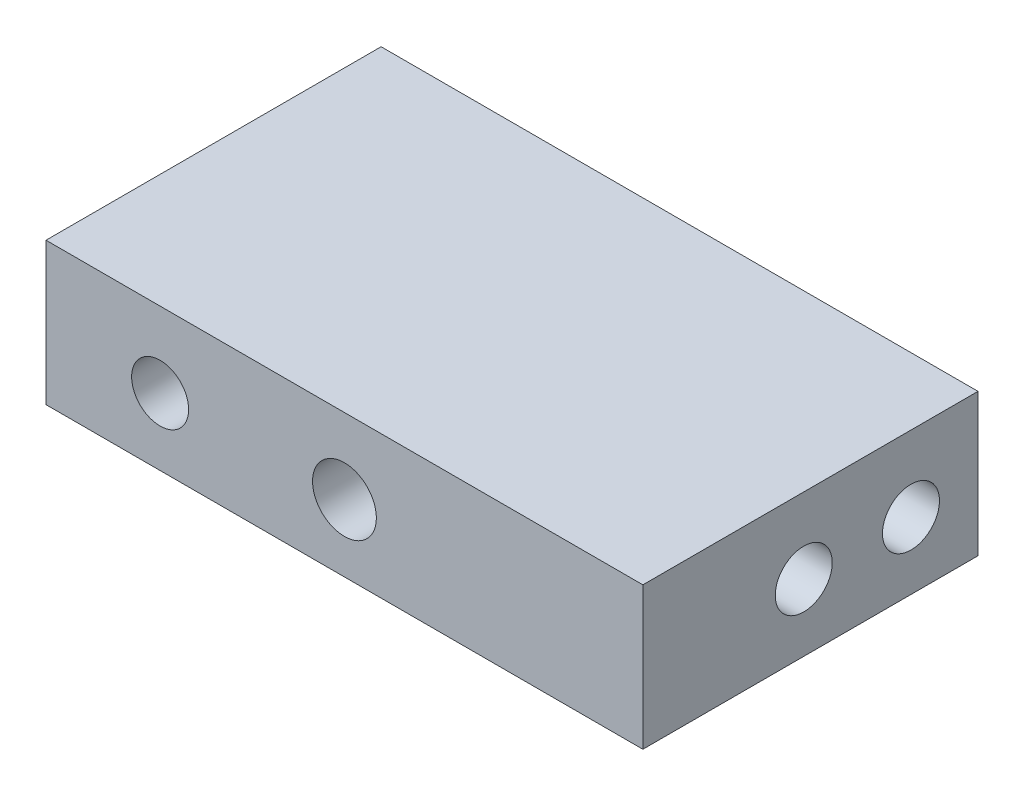
from build123d import *

# Parameters (mm, degrees)
SKETCH1_W           = 56.55
SKETCH1_H           = 12.7
BOSS_EXTRUDE1_DEPTH = 31.75
SKETCH2_R           = 2.7
SKETCH2_R_2         = 3.025
CUT_EXTRUDE1_DEPTH  = 10
SKETCH3_R           = 2.7
CUT_EXTRUDE2_DEPTH  = 8
SKETCH4_W           = 56.55
SKETCH4_H           = 31.75
BOSS_EXTRUDE2_DEPTH = 0.79375


with BuildPart() as part:
    # Sketch1 → Boss-Extrude1 (new body)
    with BuildSketch(Plane.XY):
        Rectangle(SKETCH1_W, SKETCH1_H)
    extrude(amount=BOSS_EXTRUDE1_DEPTH)

    # Sketch2 → Cut-Extrude1 (cut)
    with BuildSketch(Plane.XY.offset(31.75)):
        with Locations((-17.4625, 0)):
            Circle(SKETCH2_R)
        Circle(SKETCH2_R_2)
    extrude(amount=-CUT_EXTRUDE1_DEPTH, mode=Mode.SUBTRACT)

    # Sketch3 → Cut-Extrude2 (cut)
    with BuildSketch(Plane.ZY.offset(28.275)):
        with Locations((16.51, 0)):
            Circle(SKETCH3_R)
        with Locations((6.35, 0)):
            Circle(SKETCH3_R)
    cut_extrude2 = extrude(amount=-CUT_EXTRUDE2_DEPTH, mode=Mode.SUBTRACT)

    # Sketch4 → Boss-Extrude2 (add)
    with BuildSketch(Plane(origin=(0, 6.35, 0), x_dir=(1, 0, 0), z_dir=(0, 1, 0))):
        with Locations((0, -15.875)):
            Rectangle(SKETCH4_W, SKETCH4_H)
    extrude(amount=BOSS_EXTRUDE2_DEPTH)

    # Mirror1: Cut-Extrude2 across plane
    add(cut_extrude2.mirror(Plane(origin=(0, 0, 0), x_dir=(0, 0, 1), z_dir=(1, 0, 0))), mode=Mode.SUBTRACT)


solid = part.part
